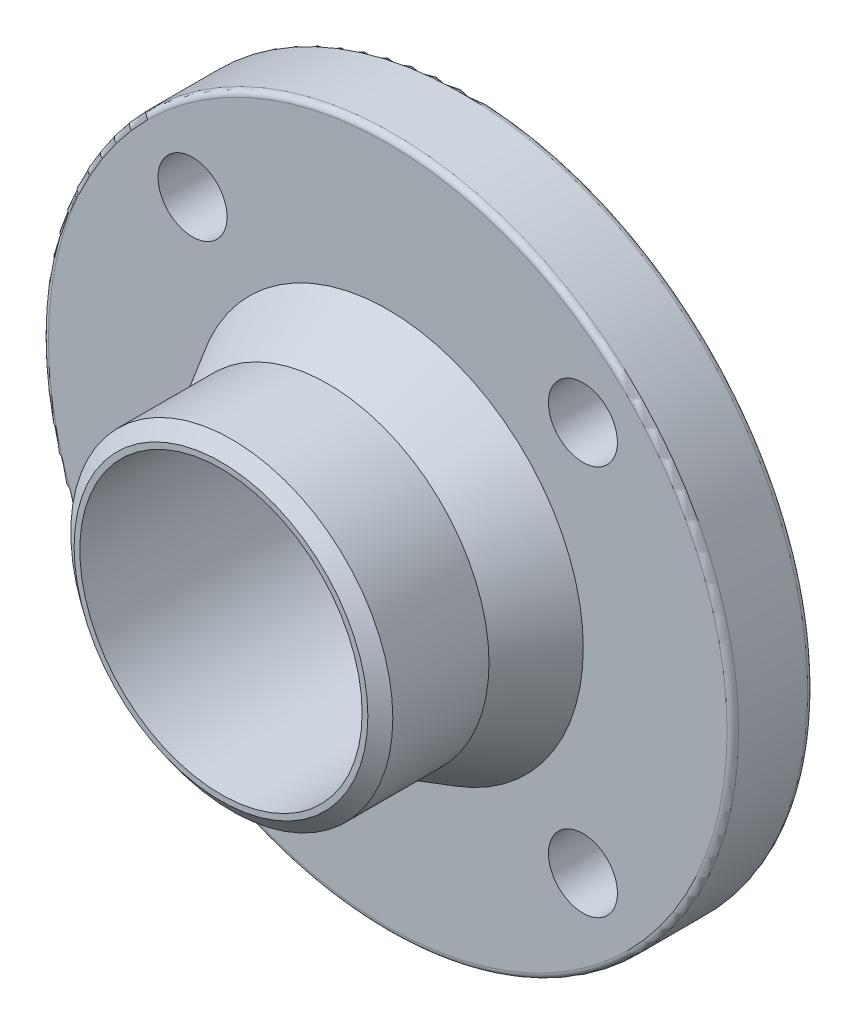
from build123d import *

# Parameters (mm, degrees)
SKETCH1_R                 = 95.25
BOSS_EXTRUDE1_DEPTH       = 23.8125
SKETCH2_R                 = 9.525
BOLTHOLE_DEPTH            = 137.792398021
BOLTHOLEPATTERN_COUNT     = 4
SKETCH5_OUTSIDE_W         = 246.592
SKETCH5_OUTSIDE_H         = 246.592
SKETCH5_OUTSIDE_R         = 63.5
RAISED_FACE_DEPTH         = 1.5875
SKETCH8_R                 = 53.975
WELD_NECK_120_DRAFT_DEPTH = 46.0375
WELD_NECK_120_DRAFT_TAPER = 30
WELD_NECK_END_REACH       = 153.737
SKETCH9_R                 = 44.45
WELD_NECK_CHAMFER1_SIZE   = 2.991731193
WELD_NECK_CHAMFER1_SIZE2  = 3.8989
SKETCH7_R                 = 38.9636
BORE_DEPTH                = 152.737099946
FILLET2_R                 = 1.5875
FILLET3_R                 = 1.5875


with BuildPart() as part:
    # Sketch1 → Boss-Extrude1 (new body)
    with BuildSketch(Plane.XY):
        Circle(SKETCH1_R)
    extrude(amount=BOSS_EXTRUDE1_DEPTH)

    # Sketch2 → BoltHole (cut, through all)
    with BuildSketch(Plane.XY):
        with Locations((53.881536726, 53.881536726)):
            Circle(SKETCH2_R)
    bolthole = extrude(amount=BOLTHOLE_DEPTH, mode=Mode.SUBTRACT)

    # BoltHolePattern: BoltHole ×4 about axis
    boltholepattern_axis = Axis((0, 0, 0), (0, 0, 1))
    for i in range(1, BOLTHOLEPATTERN_COUNT):
        add(bolthole.rotate(boltholepattern_axis, i * 360 / BOLTHOLEPATTERN_COUNT), mode=Mode.SUBTRACT)

    # Sketch5 outside → Raised Face (cut)
    with BuildSketch(Plane(origin=(0, 0, 0), x_dir=(-1, 0, 0), z_dir=(0, 0, -1))):
        Rectangle(SKETCH5_OUTSIDE_W, SKETCH5_OUTSIDE_H)
        Circle(SKETCH5_OUTSIDE_R, mode=Mode.SUBTRACT)
    extrude(amount=-RAISED_FACE_DEPTH, mode=Mode.SUBTRACT)

    # Sketch8 → Weld Neck 120 Draft (add)
    with BuildSketch(Plane.XY.offset(23.8125)):
        Circle(SKETCH8_R)
    extrude(amount=WELD_NECK_120_DRAFT_DEPTH, taper=WELD_NECK_120_DRAFT_TAPER)

    # Sketch9 → Weld Neck End (add, up to next)
    with BuildSketch(Plane.XY.offset(69.85), mode=Mode.PRIVATE) as weld_neck_end_sk1:
        Circle(SKETCH9_R)
    weld_neck_end_tool1 = extrude(weld_neck_end_sk1.sketch, amount=-WELD_NECK_END_REACH, mode=Mode.PRIVATE) - part.part
    add(weld_neck_end_tool1.solids().sort_by_distance((0, 0, 69.85))[0])

    # Weld Neck Chamfer1
    weld_neck_chamfer1_edges = [part.edges().sort_by_distance(p)[0] for p in [
        (-44.45, 0, 69.85),
    ]]
    weld_neck_chamfer1_side = [part.faces().sort_by_distance(p)[0] for p in [
        (-44.45, 0, 55.080141971),
    ]]
    chamfer(weld_neck_chamfer1_edges, length=WELD_NECK_CHAMFER1_SIZE, length2=WELD_NECK_CHAMFER1_SIZE2, reference=weld_neck_chamfer1_side[0])

    # Sketch7 → Bore (cut, through all)
    with BuildSketch(Plane.XY):
        Circle(SKETCH7_R)
    extrude(amount=BORE_DEPTH, mode=Mode.SUBTRACT)

    # Fillet2
    fillet2_edges = [part.edges().sort_by_distance(p)[0] for p in [
        (-95.25, 0, 1.5875),
        (-95.25, 0, 23.8125),
    ]]
    fillet(fillet2_edges, radius=FILLET2_R)

    # Fillet3
    fillet3_edges = [part.edges().sort_by_distance(p)[0] for p in [
        (63.5, 0, 1.5875),
    ]]
    fillet(fillet3_edges, radius=FILLET3_R - 0.0001)  # a hair under: the kernel refuses the full size


solid = part.part
